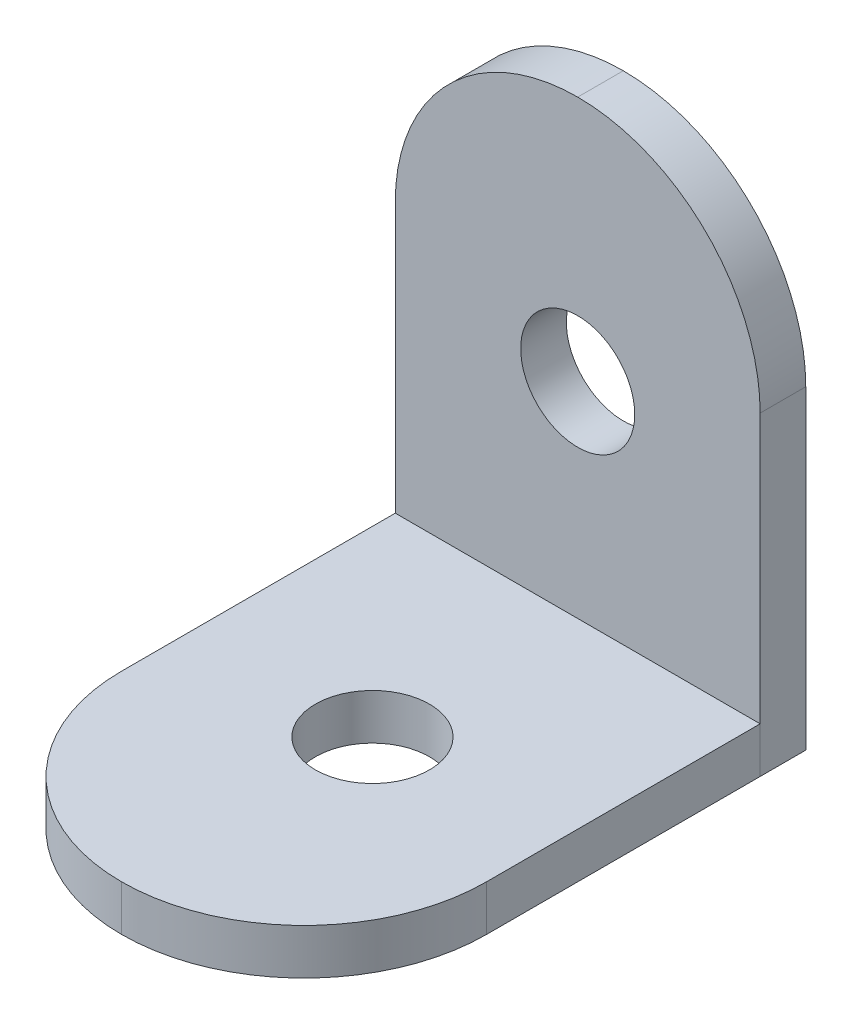
from build123d import *

# Parameters (mm, degrees)
SKETCH_1_W          = 16
SKETCH_1_H          = 2
EXTRUDE_1_DEPTH     = 20
FILLET_1_R          = 8
FILLET_2_R          = 8
SKETCH_2_W          = 16
SKETCH_2_H          = 2
EXTRUDE_2_DEPTH     = 21.8
FILLET_3_R          = 8
FILLET_4_R          = 8
SKETCH_4_R          = 2.5
CUT_EXTRUDE_2_DEPTH = 2
SKETCH_6_R          = 2.5
CUT_EXTRUDE_3_DEPTH = 3


with BuildPart() as part:
    # 草图1 → 凸台-拉伸1 (new body)
    with BuildSketch(Plane.XY):
        with Locations((8, 1)):
            Rectangle(SKETCH_1_W, SKETCH_1_H)
    extrude(amount=EXTRUDE_1_DEPTH)

    # 圆角1
    fillet_1_edges = [part.edges().sort_by_distance(p)[0] for p in [
        (0, 1, 20),
    ]]
    fillet(fillet_1_edges, radius=FILLET_1_R)

    # 圆角2
    fillet_2_edges = [part.edges().sort_by_distance(p)[0] for p in [
        (16, 1, 20),
    ]]
    fillet(fillet_2_edges, radius=FILLET_2_R - 0.0001)  # a hair under: the kernel refuses the full size

    # 草图4 → 切除-拉伸2 (cut)
    with BuildSketch(Plane(origin=(0, 2, 0), x_dir=(1, 0, 0), z_dir=(0, 1, 0))):
        with Locations(Location((8, -9, 0), (0, 0, 270))):
            Circle(SKETCH_4_R)
    extrude(amount=-CUT_EXTRUDE_2_DEPTH, mode=Mode.SUBTRACT)


with BuildPart() as body_2:
    # 草图2 → 凸台-拉伸2 (new body)
    with BuildSketch(Plane(origin=(0, 0, 0), x_dir=(1, 0, 0), z_dir=(0, 1, 0))):
        with Locations((8, 1)):
            Rectangle(SKETCH_2_W, SKETCH_2_H)
    extrude(amount=EXTRUDE_2_DEPTH)

    # 圆角3
    fillet_3_edges = [body_2.edges().sort_by_distance(p)[0] for p in [
        (16, 21.8, -1),
    ]]
    fillet(fillet_3_edges, radius=FILLET_3_R)

    # 圆角4
    fillet_4_edges = [body_2.edges().sort_by_distance(p)[0] for p in [
        (0, 21.8, -1),
    ]]
    fillet(fillet_4_edges, radius=FILLET_4_R - 0.0001)  # a hair under: the kernel refuses the full size

    # 草图6 → 切除-拉伸3 (cut)
    with BuildSketch(Plane.XY):
        with Locations((8, 11)):
            Circle(SKETCH_6_R)
    extrude(amount=-CUT_EXTRUDE_3_DEPTH, mode=Mode.SUBTRACT)


solid = Compound([part.part, body_2.part])
